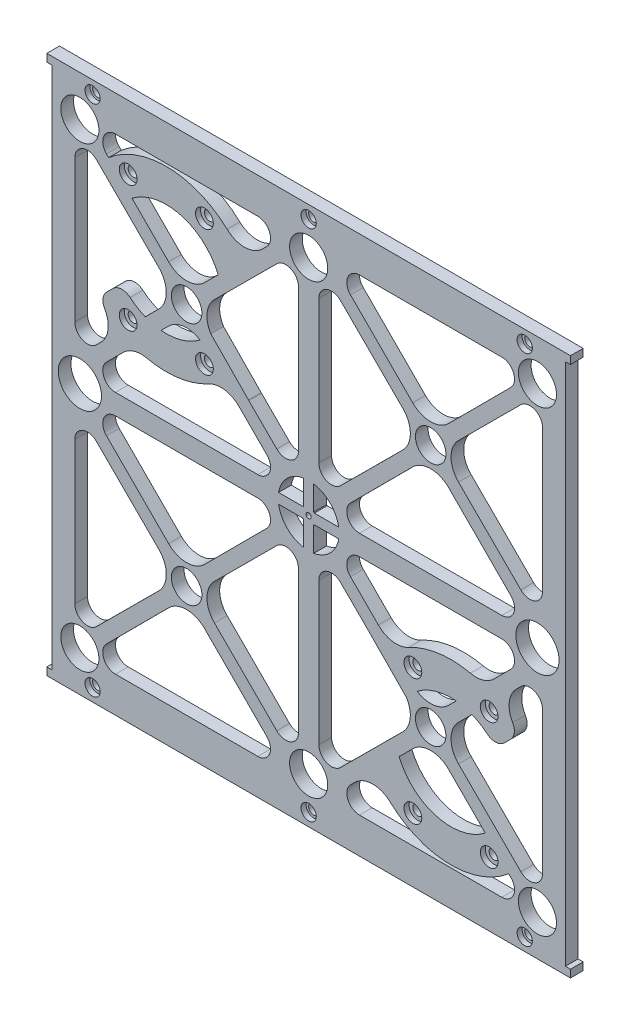
from build123d import *

# Parameters (mm, degrees)
P_IDAT_VYSUNUT_M1_DEPTH       = 5
SKICA2_R                      = 2
ODEBRAT_VYSUNUT_M1_DEPTH      = 148.885090526
ODEBRAT_VYSUNUT_M7_DEPTH      = 148.885090526
ODEBRAT_VYSUNUT_M7_DEPTH_BACK = 2
SKICA9_R                      = 3
SKICA4_R                      = 6
ODEBRAT_VYSUNUT_M3_DEPTH      = 10
SKICA5_R                      = 35
SKICA5_R_2                    = 22
P_IDAT_VYSUNUT_M2_DEPTH       = 5
ODEBRAT_VYSUNUT_M4_DEPTH      = 148.885090526
ODEBRAT_VYSUNUT_M4_DEPTH_BACK = 2
SKICA6_R                      = 3.5
SKICA7_R                      = 2
ODEBRAT_VYSUNUT_M5_DEPTH      = 148.885090526
ZAOBLIT1_R                    = 10
SKICA8_R                      = 1
ODEBRAT_VYSUNUT_M6_DEPTH      = 10
SKICA10_R                     = 8.5
SKICA10_R_2                   = 7.5
ODEBRAT_VYSUNUT_M8_DEPTH      = 148.885090526
ZAOBLIT2_R                    = 5


with BuildPart() as part:
    # Skica1 → Přidat vysunutím1 (new body)
    with BuildSketch(Plane.XY):
        Polygon((-103, 106), (103, 106), (103, 103), (101, 103), (101, -103), (103, -103), (103, -106), (-103, -106), (-103, -103), (-101, -103), (-101, 103), (-103, 103), align=None)
    extrude(amount=P_IDAT_VYSUNUT_M1_DEPTH)

    # Skica2 → Odebrat vysunutím1 (cut, through all)
    with BuildSketch(Plane.XY.offset(5)):
        with Locations((-85, 101)):
            Circle(SKICA2_R)
        with Locations((0, 101)):
            Circle(SKICA2_R)
        with Locations((85, 101)):
            Circle(SKICA2_R)
        with Locations(Location((-85, -101, 0), (0, 0, 180))):
            Circle(SKICA2_R)
        with Locations(Location((0, -101, 0), (0, 0, 180))):
            Circle(SKICA2_R)
        with Locations(Location((85, -101, 0), (0, 0, 180))):
            Circle(SKICA2_R)
    extrude(amount=-ODEBRAT_VYSUNUT_M1_DEPTH, mode=Mode.SUBTRACT)

    # Skica9 → Odebrat vysunutím7 (cut, two sides: drawn at the far end of the back side and taken through both)
    with BuildSketch(Plane.XY.offset(5).offset(-ODEBRAT_VYSUNUT_M7_DEPTH_BACK)):
        with Locations(Location((-85, 101, 0), (0, 0, 180))):
            Circle(SKICA9_R)
        with Locations(Location((0, 101, 0), (0, 0, 180))):
            Circle(SKICA9_R)
        with Locations(Location((85, 101, 0), (0, 0, 180))):
            Circle(SKICA9_R)
        with Locations(Location((85, -101, 0), (0, 0, 180))):
            Circle(SKICA9_R)
        with Locations(Location((0, -101, 0), (0, 0, 180))):
            Circle(SKICA9_R)
        with Locations(Location((-85, -101, 0), (0, 0, 180))):
            Circle(SKICA9_R)
    extrude(amount=ODEBRAT_VYSUNUT_M7_DEPTH + ODEBRAT_VYSUNUT_M7_DEPTH_BACK, mode=Mode.SUBTRACT)

    # Skica4 → Odebrat vysunutím3 (cut)
    with BuildSketch(Plane.XY.offset(5)):
        with Locations((48, 48)):
            Circle(SKICA4_R)
        with Locations(Location((-48, 48, 0), (0, 0, 180))):
            Circle(SKICA4_R)
        with Locations(Location((48, -48, 0), (0, 0, 180))):
            Circle(SKICA4_R)
        with Locations((-48, -48)):
            Circle(SKICA4_R)
        with BuildLine():
            Line((40.918682945, 58.939196308), (16.459341473, 83.469598154))
            ThreePointArc((16.459341473, 83.469598154), (15.381991272, 88.916766909), (20, 92))
            Line((20, 92), (76, 92))
            ThreePointArc((76, 92), (80.618008728, 88.916766909), (79.540658527, 83.469598154))
            Line((79.540658527, 83.469598154), (55.081317055, 58.939196308))
            ThreePointArc((55.081317055, 58.939196308), (48, 56), (40.918682945, 58.939196308))
        make_face()
        with BuildLine():
            Line((37.060803692, 55.081317055), (12.530401846, 79.540658527))
            ThreePointArc((12.530401846, 79.540658527), (7.083233091, 80.618008728), (4, 76))
            Line((4, 76), (4, 20))
            ThreePointArc((4, 20), (7.083233091, 15.381991272), (12.530401846, 16.459341473))
            Line((12.530401846, 16.459341473), (37.060803692, 40.918682945))
            ThreePointArc((37.060803692, 40.918682945), (40, 48), (37.060803692, 55.081317055))
        make_face()
        with BuildLine():
            Line((58.939196308, 40.918682945), (83.469598154, 16.459341473))
            ThreePointArc((83.469598154, 16.459341473), (88.916766909, 15.381991272), (92, 20))
            Line((92, 20), (92, 76))
            ThreePointArc((92, 76), (88.916766909, 80.618008728), (83.469598154, 79.540658527))
            Line((83.469598154, 79.540658527), (58.939196308, 55.081317055))
            ThreePointArc((58.939196308, 55.081317055), (56, 48), (58.939196308, 40.918682945))
        make_face()
        with BuildLine():
            Line((40.918682945, 37.060803692), (16.459341473, 12.530401846))
            ThreePointArc((16.459341473, 12.530401846), (15.381991272, 7.083233091), (20, 4))
            Line((20, 4), (76, 4))
            ThreePointArc((76, 4), (80.618008728, 7.083233091), (79.540658527, 12.530401846))
            Line((79.540658527, 12.530401846), (55.081317055, 37.060803692))
            ThreePointArc((55.081317055, 37.060803692), (48, 40), (40.918682945, 37.060803692))
        make_face()
        with BuildLine():
            Line((-40.918682945, 58.939196308), (-16.459341473, 83.469598154))
            ThreePointArc((-16.459341473, 83.469598154), (-15.381991272, 88.916766909), (-20, 92))
            Line((-20, 92), (-76, 92))
            ThreePointArc((-76, 92), (-80.618008728, 88.916766909), (-79.540658527, 83.469598154))
            Line((-79.540658527, 83.469598154), (-55.081317055, 58.939196308))
            ThreePointArc((-55.081317055, 58.939196308), (-48, 56), (-40.918682945, 58.939196308))
        make_face()
        with BuildLine():
            Line((-58.939196308, 55.081317055), (-83.469598154, 79.540658527))
            ThreePointArc((-83.469598154, 79.540658527), (-88.916766909, 80.618008728), (-92, 76))
            Line((-92, 76), (-92, 20))
            ThreePointArc((-92, 20), (-88.916766909, 15.381991272), (-83.469598154, 16.459341473))
            Line((-83.469598154, 16.459341473), (-58.939196308, 40.918682945))
            ThreePointArc((-58.939196308, 40.918682945), (-56, 48), (-58.939196308, 55.081317055))
        make_face()
        with BuildLine():
            Line((-55.081317055, 37.060803692), (-79.540658527, 12.530401846))
            ThreePointArc((-79.540658527, 12.530401846), (-80.618008728, 7.083233091), (-76, 4))
            Line((-76, 4), (-20, 4))
            ThreePointArc((-20, 4), (-15.381991272, 7.083233091), (-16.459341473, 12.530401846))
            Line((-16.459341473, 12.530401846), (-40.918682945, 37.060803692))
            ThreePointArc((-40.918682945, 37.060803692), (-48, 40), (-55.081317055, 37.060803692))
        make_face()
        with BuildLine():
            Line((-37.060803692, 40.918682945), (-12.530401846, 16.459341473))
            ThreePointArc((-12.530401846, 16.459341473), (-7.083233091, 15.381991272), (-4, 20))
            Line((-4, 20), (-4, 76))
            ThreePointArc((-4, 76), (-7.083233091, 80.618008728), (-12.530401846, 79.540658527))
            Line((-12.530401846, 79.540658527), (-37.060803692, 55.081317055))
            ThreePointArc((-37.060803692, 55.081317055), (-40, 48), (-37.060803692, 40.918682945))
        make_face()
        with BuildLine():
            Line((40.918682945, -58.939196308), (16.459341473, -83.469598154))
            ThreePointArc((16.459341473, -83.469598154), (15.381991272, -88.916766909), (20, -92))
            Line((20, -92), (76, -92))
            ThreePointArc((76, -92), (80.618008728, -88.916766909), (79.540658527, -83.469598154))
            Line((79.540658527, -83.469598154), (55.081317055, -58.939196308))
            ThreePointArc((55.081317055, -58.939196308), (48, -56), (40.918682945, -58.939196308))
        make_face()
        with BuildLine():
            Line((58.939196308, -55.081317055), (83.469598154, -79.540658527))
            ThreePointArc((83.469598154, -79.540658527), (88.916766909, -80.618008728), (92, -76))
            Line((92, -76), (92, -20))
            ThreePointArc((92, -20), (88.916766909, -15.381991272), (83.469598154, -16.459341473))
            Line((83.469598154, -16.459341473), (58.939196308, -40.918682945))
            ThreePointArc((58.939196308, -40.918682945), (56, -48), (58.939196308, -55.081317055))
        make_face()
        with BuildLine():
            Line((55.081317055, -37.060803692), (79.540658527, -12.530401846))
            ThreePointArc((79.540658527, -12.530401846), (80.618008728, -7.083233091), (76, -4))
            Line((76, -4), (20, -4))
            ThreePointArc((20, -4), (15.381991272, -7.083233091), (16.459341473, -12.530401846))
            Line((16.459341473, -12.530401846), (40.918682945, -37.060803692))
            ThreePointArc((40.918682945, -37.060803692), (48, -40), (55.081317055, -37.060803692))
        make_face()
        with BuildLine():
            Line((37.060803692, -40.918682945), (12.530401846, -16.459341473))
            ThreePointArc((12.530401846, -16.459341473), (7.083233091, -15.381991272), (4, -20))
            Line((4, -20), (4, -76))
            ThreePointArc((4, -76), (7.083233091, -80.618008728), (12.530401846, -79.540658527))
            Line((12.530401846, -79.540658527), (37.060803692, -55.081317055))
            ThreePointArc((37.060803692, -55.081317055), (40, -48), (37.060803692, -40.918682945))
        make_face()
        with BuildLine():
            Line((-37.060803692, -55.081317055), (-12.530401846, -79.540658527))
            ThreePointArc((-12.530401846, -79.540658527), (-7.083233091, -80.618008728), (-4, -76))
            Line((-4, -76), (-4, -20))
            ThreePointArc((-4, -20), (-7.083233091, -15.381991272), (-12.530401846, -16.459341473))
            Line((-12.530401846, -16.459341473), (-37.060803692, -40.918682945))
            ThreePointArc((-37.060803692, -40.918682945), (-40, -48), (-37.060803692, -55.081317055))
        make_face()
        with BuildLine():
            Line((-55.081317055, -58.939196308), (-79.540658527, -83.469598154))
            ThreePointArc((-79.540658527, -83.469598154), (-80.618008728, -88.916766909), (-76, -92))
            Line((-76, -92), (-20, -92))
            ThreePointArc((-20, -92), (-15.381991272, -88.916766909), (-16.459341473, -83.469598154))
            Line((-16.459341473, -83.469598154), (-40.918682945, -58.939196308))
            ThreePointArc((-40.918682945, -58.939196308), (-48, -56), (-55.081317055, -58.939196308))
        make_face()
        with BuildLine():
            Line((-58.939196308, -40.918682945), (-83.469598154, -16.459341473))
            ThreePointArc((-83.469598154, -16.459341473), (-88.916766909, -15.381991272), (-92, -20))
            Line((-92, -20), (-92, -76))
            ThreePointArc((-92, -76), (-88.916766909, -80.618008728), (-83.469598154, -79.540658527))
            Line((-83.469598154, -79.540658527), (-58.939196308, -55.081317055))
            ThreePointArc((-58.939196308, -55.081317055), (-56, -48), (-58.939196308, -40.918682945))
        make_face()
        with BuildLine():
            Line((-40.918682945, -37.060803692), (-16.459341473, -12.530401846))
            ThreePointArc((-16.459341473, -12.530401846), (-15.381991272, -7.083233091), (-20, -4))
            Line((-20, -4), (-76, -4))
            ThreePointArc((-76, -4), (-80.618008728, -7.083233091), (-79.540658527, -12.530401846))
            Line((-79.540658527, -12.530401846), (-55.081317055, -37.060803692))
            ThreePointArc((-55.081317055, -37.060803692), (-48, -40), (-40.918682945, -37.060803692))
        make_face()
    extrude(amount=-ODEBRAT_VYSUNUT_M3_DEPTH, mode=Mode.SUBTRACT)

    # Skica5 → Přidat vysunutím2 (add)
    # profile 1 of 2: a face of its own
    with BuildSketch(Plane.XY.offset(5)):
        with Locations((56, -56)):
            Circle(SKICA5_R)
        with Locations((56, -56)):
            Circle(SKICA5_R_2, mode=Mode.SUBTRACT)
    # profile 2 of 2: a face of its own
    with BuildSketch(Plane.XY.offset(5)):
        with Locations((-56, 56)):
            Circle(SKICA5_R)
        with Locations((-56, 56)):
            Circle(SKICA5_R_2, mode=Mode.SUBTRACT)
    extrude(amount=-P_IDAT_VYSUNUT_M2_DEPTH)

    # Skica6 → Odebrat vysunutím4 (cut, two sides: drawn at the far end of the back side and taken through both)
    with BuildSketch(Plane.XY.offset(5).offset(-ODEBRAT_VYSUNUT_M4_DEPTH_BACK)):
        with Locations(Location((71, -31.180652708, 0), (0, 0, 180))):
            Circle(SKICA6_R)
        with Locations(Location((41, -31.180652708, 0), (0, 0, 180))):
            Circle(SKICA6_R)
        with Locations(Location((41, -80.819347292, 0), (0, 0, 180))):
            Circle(SKICA6_R)
        with Locations(Location((71, -80.819347292, 0), (0, 0, 180))):
            Circle(SKICA6_R)
        with Locations(Location((-41, 80.819347292, 0), (0, 0, 180))):
            Circle(SKICA6_R)
        with Locations(Location((-71, 80.819347292, 0), (0, 0, 180))):
            Circle(SKICA6_R)
        with Locations(Location((-71, 31.180652708, 0), (0, 0, 180))):
            Circle(SKICA6_R)
        with Locations(Location((-41, 31.180652708, 0), (0, 0, 180))):
            Circle(SKICA6_R)
    extrude(amount=ODEBRAT_VYSUNUT_M4_DEPTH + ODEBRAT_VYSUNUT_M4_DEPTH_BACK, mode=Mode.SUBTRACT)

    # Skica7 → Odebrat vysunutím5 (cut, through all)
    with BuildSketch(Plane.XY.offset(5)):
        with Locations((41, -31.180652708)):
            Circle(SKICA7_R)
        with Locations((71, -31.180652708)):
            Circle(SKICA7_R)
        with Locations((41, -80.819347292)):
            Circle(SKICA7_R)
        with Locations((71, -80.819347292)):
            Circle(SKICA7_R)
        with Locations((-71, 80.819347292)):
            Circle(SKICA7_R)
        with Locations((-41, 80.819347292)):
            Circle(SKICA7_R)
        with Locations((-71, 31.180652708)):
            Circle(SKICA7_R)
        with Locations((-41, 31.180652708)):
            Circle(SKICA7_R)
    extrude(amount=-ODEBRAT_VYSUNUT_M5_DEPTH, mode=Mode.SUBTRACT)

    # Zaoblit1
    zaoblit1_edges = [part.edges().sort_by_distance(p)[0] for p in [
        (33.267474211, -29.387366323, 2.5),
        (29.387366323, -33.267474211, 2.5),
        (23.390223399, -68.712296017, 2.5),
        (25.952643813, -73.948715447, 2.5),
        (68.712296017, -23.390223399, 2.5),
        (73.948715447, -25.952643813, 2.5),
        (-29.387366323, 33.267474211, 2.5),
        (-73.948715447, 25.952643813, 2.5),
        (-68.712296017, 23.390223399, 2.5),
        (-33.267474211, 29.387366323, 2.5),
        (-25.952643813, 73.948715447, 2.5),
        (-23.390223399, 68.712296017, 2.5),
    ]]
    fillet(zaoblit1_edges, radius=ZAOBLIT1_R)

    # Skica8 → Odebrat vysunutím6 (cut)
    with BuildSketch(Plane.XY.offset(5)):
        Circle(SKICA8_R)
    extrude(amount=-ODEBRAT_VYSUNUT_M6_DEPTH, mode=Mode.SUBTRACT)

    # Skica10 → Odebrat vysunutím8 (cut, through all)
    with BuildSketch(Plane.XY.offset(5)):
        with Locations(Location((90, 0, 0), (0, 0, 180))):
            Circle(SKICA10_R)
        with Locations((-90, 0)):
            Circle(SKICA10_R)
        with Locations((-90, -90)):
            Circle(SKICA10_R_2)
        with Locations((90, -90)):
            Circle(SKICA10_R_2)
        with Locations((90, 90)):
            Circle(SKICA10_R_2)
        with Locations((-90, 90)):
            Circle(SKICA10_R_2)
        with Locations((0, 88)):
            Circle(SKICA10_R_2)
        with Locations((0, -88)):
            Circle(SKICA10_R_2)
        Polygon((-23.526503027, 27.423588832), (-38.477930072, 42.696727266), (-34.094678895, 58.038849496), (-19.153321382, 72.936924455), align=None)
        Polygon((-82.634003577, 78.707484525), (-73.383526869, 69.483804863), (-73.383526869, 42.516195137), (-82.621667626, 33.278054379), (-92, 33.278054379), (-92, 76), align=None)
        Polygon((38.477930072, -42.696727266), (23.526503027, -27.423588832), (19.153321382, -72.936924455), (35.577741293, -56.560083275), align=None)
        Polygon((73.383526869, -69.483804863), (82.634003577, -78.707484525), (92, -76), (92, -33.278054379), (82.621667626, -33.278054379), (73.383526869, -42.516195137), align=None)
        with BuildLine():
            Line((2, 11.832159566), (2, 2.236067977))
            ThreePointArc((2, 2.236067977), (2.121320344, 2.121320344), (2.236067977, 2))
            Line((2.236067977, 2), (11.832159566, 2))
            ThreePointArc((11.832159566, 2), (8.485281374, 8.485281374), (2, 11.832159566))
        make_face()
        with BuildLine():
            Line((-2, 11.832159566), (-2, 2.236067977))
            ThreePointArc((-2, 2.236067977), (-2.121320344, 2.121320344), (-2.236067977, 2))
            Line((-2.236067977, 2), (-11.832159566, 2))
            ThreePointArc((-11.832159566, 2), (-8.485281374, 8.485281374), (-2, 11.832159566))
        make_face()
        with BuildLine():
            Line((-11.832159566, -2), (-2.236067977, -2))
            ThreePointArc((-2.236067977, -2), (-2.121320344, -2.121320344), (-2, -2.236067977))
            Line((-2, -2.236067977), (-2, -11.832159566))
            ThreePointArc((-2, -11.832159566), (-8.485281374, -8.485281374), (-11.832159566, -2))
        make_face()
        with BuildLine():
            Line((2, -11.832159566), (2, -2.236067977))
            ThreePointArc((2, -2.236067977), (2.121320344, -2.121320344), (2.236067977, -2))
            Line((2.236067977, -2), (11.832159566, -2))
            ThreePointArc((11.832159566, -2), (8.485281374, -8.485281374), (2, -11.832159566))
        make_face()
    extrude(amount=-ODEBRAT_VYSUNUT_M8_DEPTH, mode=Mode.SUBTRACT)

    # Zaoblit2
    zaoblit2_edges = [part.edges().sort_by_distance(p)[0] for p in [
        (82.621667626, -33.278054379, 2.5),
        (73.383526869, -42.516195137, 2.5),
        (-73.383526869, 42.516195137, 2.5),
        (-82.621667626, 33.278054379, 2.5),
    ]]
    fillet(zaoblit2_edges, radius=ZAOBLIT2_R - 0.0001)  # a hair under: the kernel refuses the full size


solid = part.part
